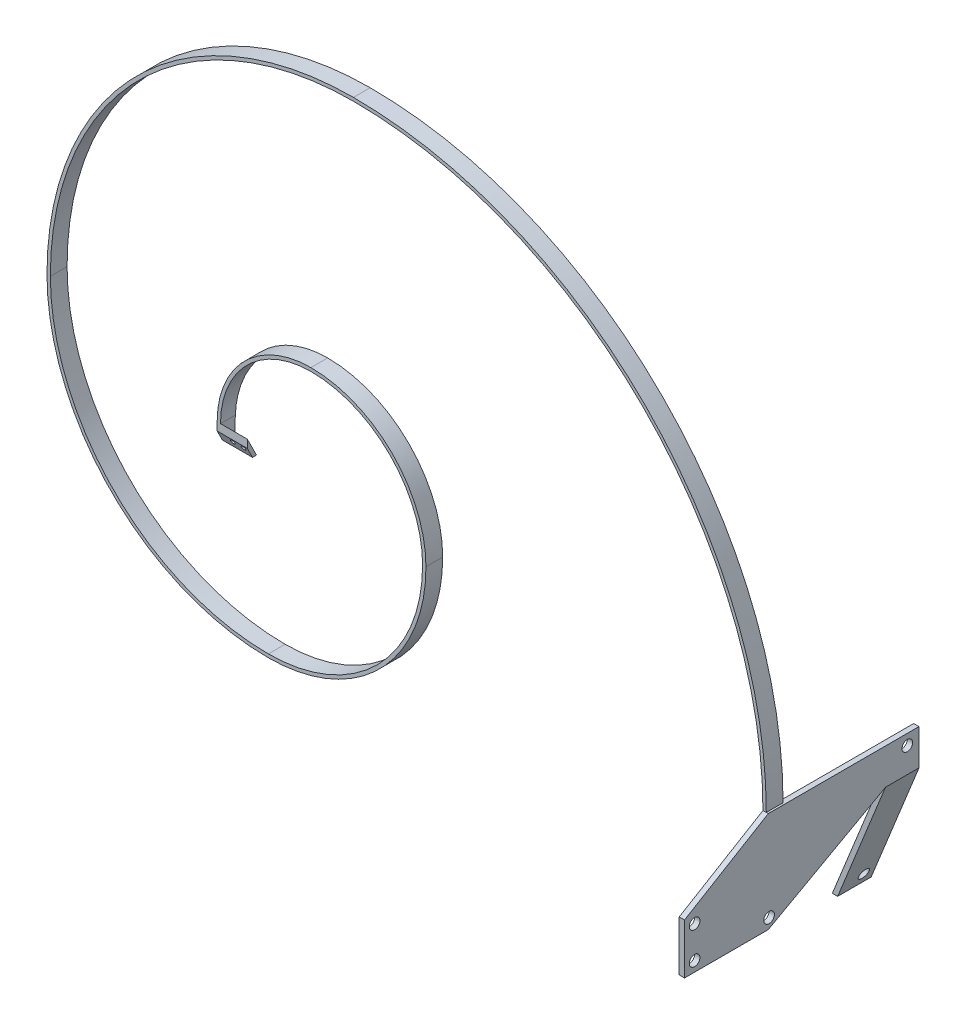
from build123d import *

# Parameters (mm, degrees)
EXTRUDE2_DEPTH     = 5
SKETCH3_W          = 1
SKETCH3_H          = 5
EXTRUDE3_DEPTH     = 10
CUT_EXTRUDE2_DEPTH = 5
EXTRUDE5_DEPTH     = 8
SKETCH8_W          = 1.5875
SKETCH8_H          = 5
EXTRUDE6_DEPTH     = 30
SKETCH9_W          = 1.5875
SKETCH9_H          = 30
EXTRUDE7_DEPTH     = 30
SKETCH10_W         = 1.5875
SKETCH10_H         = 30
EXTRUDE8_DEPTH     = 25
CUT_EXTRUDE3_DEPTH = 5
CUT_EXTRUDE4_DEPTH = 5
CUT_EXTRUDE6_DEPTH = 15
SKETCH15_R         = 0.7
CUT_EXTRUDE7_DEPTH = 10
EXTRUDE9_DEPTH     = 10
SKETCH18_R         = 1.5875
CUT_EXTRUDE8_DEPTH = 3
SKETCH19_R         = 1.5875
CUT_EXTRUDE9_DEPTH = 3


with BuildPart() as part:
    # Sketch2 → Extrude2 (new body)
    with BuildSketch(Plane.XY):
        with BuildLine():
            Line((-27.9875, 0), (-26.9875, 0))
            ThreePointArc((-26.9875, 0), (-19.083044257, 19.083044257), (0, 26.9875))
            ThreePointArc((0, 26.9875), (23.573172318, 17.223172318), (33.3375, -6.35))
            ThreePointArc((33.3375, -6.35), (19.853428439, -38.903428439), (-12.7, -52.3875))
            ThreePointArc((-12.7, -52.3875), (-58.72381262, -33.32381262), (-77.7875, 12.7))
            ThreePointArc((-77.7875, 12.7), (-51.284324863, 76.684324863), (12.7, 103.1875))
            ThreePointArc((12.7, 103.1875), (99.134965165, 67.384965165), (134.9375, -19.05))
            Line((134.9375, -19.05), (135.9375, -19.05))
            ThreePointArc((135.9375, -19.05), (99.842071946, 68.092071946), (12.7, 104.1875))
            ThreePointArc((12.7, 104.1875), (-51.991431644, 77.391431644), (-78.7875, 12.7))
            ThreePointArc((-78.7875, 12.7), (-59.430919402, -34.030919402), (-12.7, -53.3875))
            ThreePointArc((-12.7, -53.3875), (20.56053522, -39.61053522), (34.3375, -6.35))
            ThreePointArc((34.3375, -6.35), (24.280279099, 17.930279099), (0, 27.9875))
            ThreePointArc((0, 27.9875), (-19.790151038, 19.790151038), (-27.9875, 0))
        make_face()
    extrude(amount=EXTRUDE2_DEPTH)

    # Sketch3 → Extrude3 (add)
    with BuildSketch(Plane.XZ):
        with Locations((-27.4875, 2.5)):
            Rectangle(SKETCH3_W, SKETCH3_H)
    extrude(amount=EXTRUDE3_DEPTH)

    # Sketch6 → Cut-Extrude2 (cut)
    with BuildSketch(Plane(origin=(-26.9875, 0, 0), x_dir=(0, 0, -1), z_dir=(1, 0, 0))):
        Polygon((-5, -2.4), (-1.2, -10), (-5, -10), align=None)
    extrude(amount=-CUT_EXTRUDE2_DEPTH, mode=Mode.SUBTRACT)

    # Sketch7 → Extrude5 (add)
    with BuildSketch(Plane(origin=(-26.9875, 0, 0), x_dir=(0, 0, -1), z_dir=(1, 0, 0))):
        Polygon((-5, 0), (0, -10), (-1.2, -10), (-5, -2.4), align=None)
    extrude(amount=EXTRUDE5_DEPTH)

    # Sketch8 → Extrude6 (add)
    with BuildSketch(Plane.XZ.offset(19.05)):
        with Locations((135.73125, 2.5)):
            Rectangle(SKETCH8_W, SKETCH8_H)
    extrude(amount=EXTRUDE6_DEPTH)

    # Sketch9 → Extrude7 (add)
    with BuildSketch(Plane(origin=(0, 0, 0), x_dir=(-1, 0, 0), z_dir=(0, 0, -1))):
        with Locations((-135.73125, -34.05)):
            Rectangle(SKETCH9_W, SKETCH9_H)
    extrude(amount=EXTRUDE7_DEPTH)

    # Sketch10 → Extrude8 (add)
    with BuildSketch(Plane.XY.offset(5)):
        with Locations((135.73125, -34.05)):
            Rectangle(SKETCH10_W, SKETCH10_H)
    extrude(amount=EXTRUDE8_DEPTH)

    # Sketch11 → Cut-Extrude3 (cut)
    with BuildSketch(Plane.ZY.offset(-134.9375)):
        Polygon((5, -19.05), (30, -34.05), (30, -19.05), align=None)
    extrude(amount=-CUT_EXTRUDE3_DEPTH, mode=Mode.SUBTRACT)

    # Sketch12 → Cut-Extrude4 (cut)
    with BuildSketch(Plane.ZY.offset(-134.9375)):
        Polygon((5, -49.05), (-30, -29.728735128), (-30, -49.05), align=None)
    extrude(amount=-CUT_EXTRUDE4_DEPTH, mode=Mode.SUBTRACT)

    # Sketch14 → Cut-Extrude6 (cut)
    with BuildSketch(Plane.ZY.offset(27.9875)):
        Polygon((0, -5.5), (0, 14), (0.8, -5.5), (4.7625, -5.5), (4.7625, -10), (0, -10), align=None)
    extrude(amount=-CUT_EXTRUDE6_DEPTH, mode=Mode.SUBTRACT)

    # Sketch15 → Cut-Extrude7 (cut)
    with BuildSketch(Plane(origin=(0, -2, 4), x_dir=(-1, 0, 0), z_dir=(0, 0.4472135954999579, -0.894427190999916))):
        with Locations((23.8125, -1)):
            Circle(SKETCH15_R)
        with Locations((20.6375, -1)):
            Circle(SKETCH15_R)
    extrude(amount=-CUT_EXTRUDE7_DEPTH, mode=Mode.SUBTRACT)

    # Sketch17 → Extrude9 (add)
    with BuildSketch(Plane(origin=(0, 0, -30), x_dir=(-1, 0, 0), z_dir=(0, 0, -1))):
        Polygon((-136.525, -19.05), (-136.525, -29.728735128), (-122.24, -65.09), (-120.65, -65.09), (-134.9375, -29.728735128), (-134.9375, -19.05), align=None)
    extrude(amount=EXTRUDE9_DEPTH)

    # Sketch18 → Cut-Extrude8 (cut)
    with BuildSketch(Plane(origin=(126.326271119, -51.041347224, 0), x_dir=(0, 0, 1), z_dir=(-0.9271781934127812, 0.374620604958952, 0))):
        with Locations((-36.5125, -11.1125)):
            Circle(SKETCH18_R)
    extrude(amount=-CUT_EXTRUDE8_DEPTH, mode=Mode.SUBTRACT)

    # Sketch19 → Cut-Extrude9 (cut)
    with BuildSketch(Plane(origin=(136.525, 0, 0), x_dir=(0, 0, -1), z_dir=(1, 0, 0))):
        with Locations((-26.9875, -46.0375)):
            Circle(SKETCH19_R)
        with Locations((-26.9875, -36.5125)):
            Circle(SKETCH19_R)
        with Locations((-4.7625, -46.0375)):
            Circle(SKETCH19_R)
        with Locations((36.5125, -22.225)):
            Circle(SKETCH19_R)
    extrude(amount=-CUT_EXTRUDE9_DEPTH, mode=Mode.SUBTRACT)


solid = part.part
